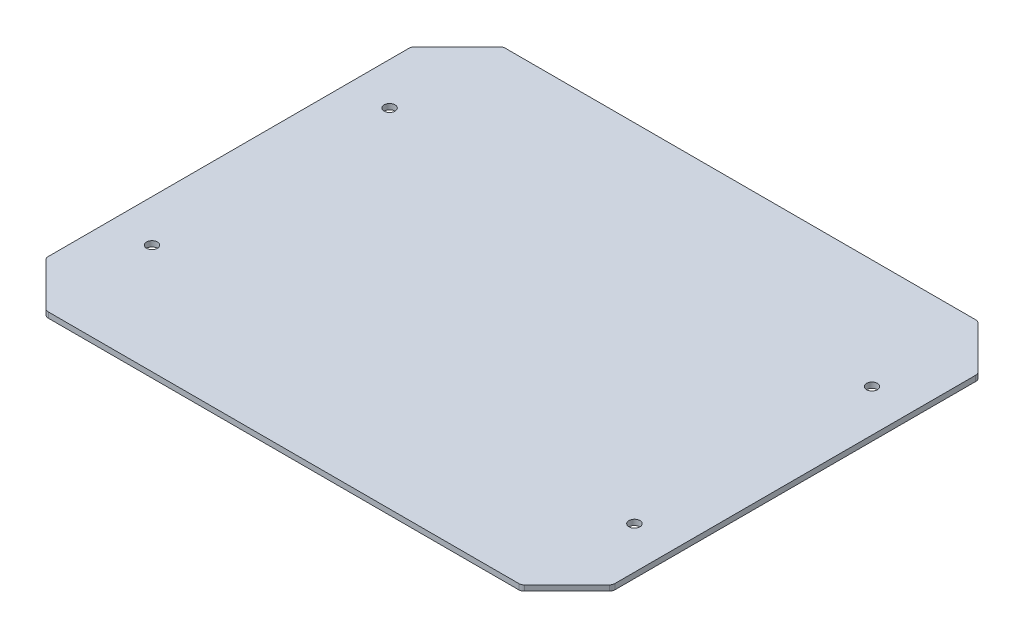
from build123d import *

# Parameters (mm, degrees)
BOSS_EXTRU_1_DEPTH   = 3
CONG_1_R             = 3
ESQUISSE2_R          = 3
PER_AGE_PROFIL_DEPTH = 200.145675323


with BuildPart() as part:
    # Esquisse1 → Boss.-Extru.1 (new body)
    with BuildSketch(Plane(origin=(0, 0, 0), x_dir=(1, 0, 0), z_dir=(0, 1, 0))):
        Polygon((-130, 125), (130, 125), (155, 100), (155, -100), (130, -125), (-130, -125), (-155, -100), (-155, 100), align=None)
    extrude(amount=BOSS_EXTRU_1_DEPTH)

    # Congé1
    cong_1_edges = [part.edges().sort_by_distance(p)[0] for p in [
        (-130, 1.5, 125),
        (-155, 1.5, 100),
        (130, 1.5, 125),
        (155, 1.5, 100),
        (155, 1.5, -100),
        (130, 1.5, -125),
        (-130, 1.5, -125),
        (-155, 1.5, -100),
    ]]
    fillet(cong_1_edges, radius=CONG_1_R)

    # Esquisse2 → Perçage Profilé (cut, through all)
    with BuildSketch(Plane(origin=(0, 3, 0), x_dir=(1, 0, 0), z_dir=(0, 1, 0))):
        with Locations((-132, 65)):
            Circle(ESQUISSE2_R)
        with Locations((-132, -65)):
            Circle(ESQUISSE2_R)
        with Locations((132, -65)):
            Circle(ESQUISSE2_R)
        with Locations((132, 65)):
            Circle(ESQUISSE2_R)
    extrude(amount=-PER_AGE_PROFIL_DEPTH, mode=Mode.SUBTRACT)


solid = part.part
